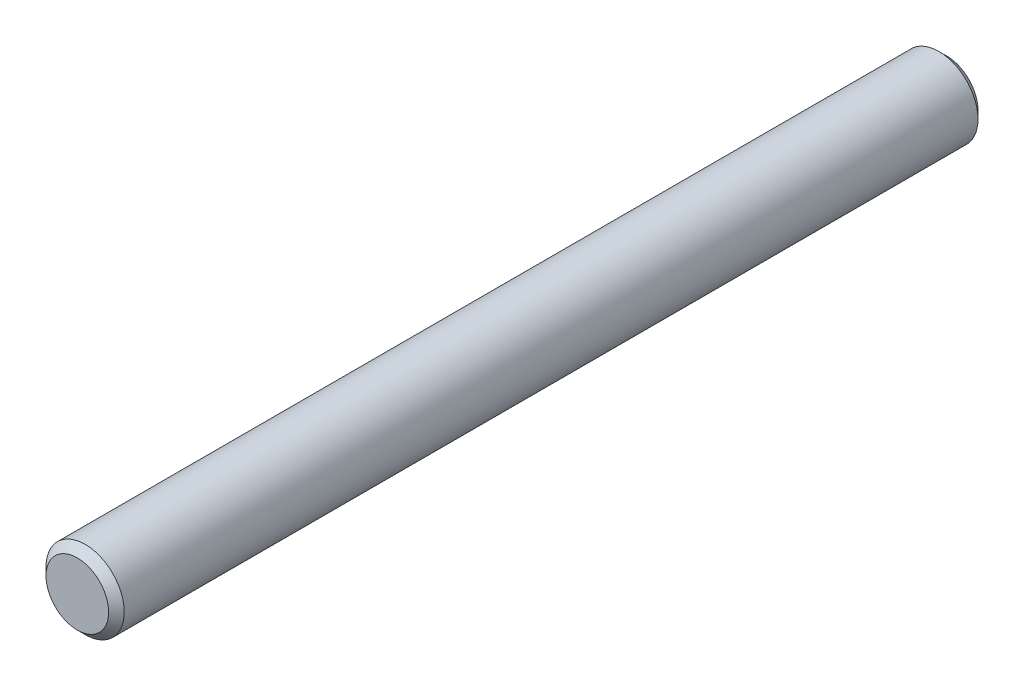
from build123d import *

# Parameters (mm, degrees)
SKETCH1_R      = 4.7625
EXTRUDE1_DEPTH = 52.9
CHAMFER1_SIZE  = 0.9525


with BuildPart() as part:
    # Sketch1 → Extrude1 (new, symmetric)
    with BuildSketch(Plane.XY):
        Circle(SKETCH1_R)
    extrude(amount=EXTRUDE1_DEPTH, both=True)

    # Chamfer1
    chamfer1_edges = [part.edges().sort_by_distance(p)[0] for p in [
        (-4.7625, 0, -52.9),
        (-4.7625, 0, 52.9),
    ]]
    chamfer(chamfer1_edges, length=CHAMFER1_SIZE)


solid = part.part
